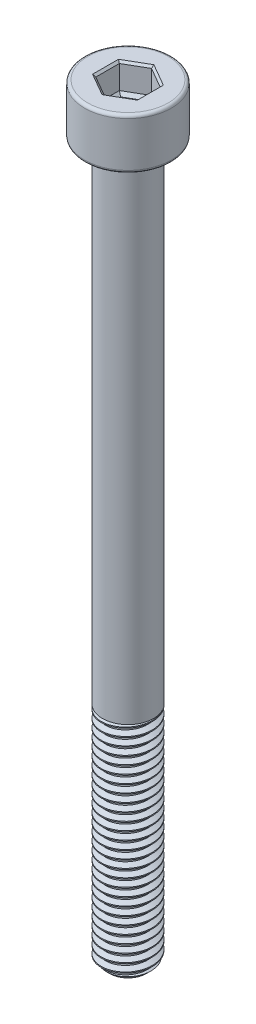
from build123d import *

# Parameters (mm, degrees)
SKETCH1_R           = 2.5
BOSS_EXTRUDE1_DEPTH = 22
THREAD1_PITCH       = 0.8
SKETCH2_R           = 2.5
BOSS_EXTRUDE2_DEPTH = 48
SKETCH3_R           = 4.25
BOSS_EXTRUDE3_DEPTH = 5
FILLET1_R           = 0.3
CUT_EXTRUDE1_DEPTH  = 2.5
CHAMFER1_SIZE       = 0.2
CUT_EXTRUDE2_DEPTH  = 0.3
CUT_EXTRUDE2_DRAFT  = -45


with BuildPart() as part:
    # Sketch1 → Boss-Extrude1 (new body)
    with BuildSketch(Plane(origin=(0, 0, 0), x_dir=(1, 0, 0), z_dir=(0, 1, 0))):
        with Locations(Location((0, 0, 0), (0, 0, 270))):
            Circle(SKETCH1_R)
    extrude(amount=BOSS_EXTRUDE1_DEPTH)

    # Thread1: arcs per turn and ends read off the stored shape
    # Thread1: the profile of Thread Profile1 profile screwed along a right-hand helix through 30 turns, 8 arcs to a turn; built about Z, then put on its axis
    thread1_z = Axis((0, 0, 0), (0, 0, 1))
    thread1_corners = [(2.5003, 0, -0.000173205), (2.5003, 0, 0.700173203), (2.0669873, 0, 0.449999999), (2.0669873, 0, 0.249999999)]
    with BuildLine(mode=Mode.PRIVATE) as thread1_profile:
        Line(thread1_corners[0], thread1_corners[1])
        Line(thread1_corners[1], thread1_corners[2])
        Line(thread1_corners[2], thread1_corners[3])
        Line(thread1_corners[3], thread1_corners[0])
    thread1_cap = Face(thread1_profile.wire())
    thread1_turn_angles = [0, 22.5, 45, 67.5, 90, 112.5, 135, 157.5, 180, 202.5, 225, 247.5, 270, 292.5, 315, 337.5, 360]
    thread1_turn_weights = [1, 0.9238795325112867, 1, 0.9238795325112867, 1, 0.9238795325112867, 1, 0.9238795325112867, 1, 0.9238795325112867, 1, 0.9238795325112867, 1, 0.9238795325112867, 1, 0.9238795325112867, 1]
    thread1_turn_rails = [Edge.make_bspline([Vector(p[0], p[1], 0).rotate(thread1_z, thread1_turn_angles[k]) / thread1_turn_weights[k] + Vector(0, 0, p[2] + THREAD1_PITCH * thread1_turn_angles[k] / 360) for k in range(17)], [0, 0, 0, 1, 1, 2, 2, 3, 3, 4, 4, 5, 5, 6, 6, 7, 7, 8, 8, 8], 2, thread1_turn_weights) for p in thread1_corners]
    thread1_turn_sides = [Face.make_surface_from_curves(thread1_turn_rails[p[0]], thread1_turn_rails[p[1]]) for p in [(0, 1), (1, 2), (2, 3), (3, 0)]]
    thread1 = Plane(origin=(0, 23, 0), x_dir=(-1, 0, 0), z_dir=(0, -1, 0)) * Solid(Shell([*[p.moved(Location((0, 0, THREAD1_PITCH * i))) for i in range(30) for p in thread1_turn_sides], thread1_cap, thread1_cap.rotate(thread1_z, 10800).moved(Location((0, 0, THREAD1_PITCH * 10800 / 360)))]))
    add(thread1, mode=Mode.SUBTRACT)

    # Sketch2 → Boss-Extrude2 (add)
    with BuildSketch(Plane(origin=(0, 22, 0), x_dir=(1, 0, 0), z_dir=(0, 1, 0))):
        with Locations(Location((0, 0, 0), (0, 0, 90))):
            Circle(SKETCH2_R)
    extrude(amount=BOSS_EXTRUDE2_DEPTH)

    # Sketch3 → Boss-Extrude3 (add)
    with BuildSketch(Plane(origin=(0, 70, 0), x_dir=(1, 0, 0), z_dir=(0, 1, 0))):
        with Locations(Location((0, 0, 0), (0, 0, 270))):
            Circle(SKETCH3_R)
    extrude(amount=BOSS_EXTRUDE3_DEPTH)

    # Fillet1
    fillet1_edges = [part.edges().sort_by_distance(p)[0] for p in [
        (0, 70, -4.25),
        (0, 75, -4.25),
    ]]
    fillet(fillet1_edges, radius=FILLET1_R)

    # Sketch4 → Cut-Revolve1 (revolve, cut)
    with BuildSketch(Plane.XY, mode=Mode.PRIVATE) as cut_revolve1_sk:
        Polygon((2.51, 0), (2.51, 0.7), (1.81, 0), align=None)
    revolve(cut_revolve1_sk.sketch.rotate(Axis((0, 0, 0), (0, 1, 0)), 90), axis=Axis((0, 0, 0), (0, 1, 0)), mode=Mode.SUBTRACT)

    # Sketch5 → Cut-Extrude1 (cut)
    with BuildSketch(Plane(origin=(0, 75, 0), x_dir=(1, 0, 0), z_dir=(0, 1, 0))):
        Polygon((0, 2.309401077), (-2, 1.154700538), (-2, -1.154700538), (0, -2.309401077), (2, -1.154700538), (2, 1.154700538), align=None)
    extrude(amount=-CUT_EXTRUDE1_DEPTH, mode=Mode.SUBTRACT)

    # Chamfer1
    chamfer1_edges = [part.edges().sort_by_distance(p)[0] for p in [
        (1, 75, -1.732050808),
        (-1, 75, -1.732050808),
        (-2, 75, 0),
        (-1, 75, 1.732050808),
        (1, 75, 1.732050808),
        (2, 75, 0),
    ]]
    chamfer(chamfer1_edges, length=CHAMFER1_SIZE)


with BuildPart() as cut_extrude2_tool:
    # Sketch6 → Cut-Extrude2 (with draft: the straight prism first)
    with BuildSketch(Plane(origin=(0, 72.5, 0), x_dir=(1, 0, 0), z_dir=(0, 1, 0))):
        Polygon((0, 2.309401077), (-2, 1.154700538), (-2, -1.154700538), (0, -2.309401077), (2, -1.154700538), (2, 1.154700538), align=None)
    extrude(amount=-CUT_EXTRUDE2_DEPTH)
    # Cut-Extrude2: the draft: its side faces are tilted about the plane it starts from
    cut_extrude2_sides = [cut_extrude2_tool.faces().sort_by_distance(p)[0] for p in [
        (-1, 72.35, -1.732050808),
        (-2, 72.35, 0),
        (-1, 72.35, 1.732050808),
        (1, 72.35, 1.732050808),
        (2, 72.35, 0),
        (1, 72.35, -1.732050808),
    ]]
    draft(cut_extrude2_sides, Plane(origin=(0, 72.5, 0), x_dir=(1, 0, 0), z_dir=(0, 1, 0)), CUT_EXTRUDE2_DRAFT)


with BuildPart() as part_1:
    add(part.part)

    # Cut-Extrude2: cut by cut_extrude2_tool
    add(cut_extrude2_tool.part, mode=Mode.SUBTRACT)


solid = part_1.part
